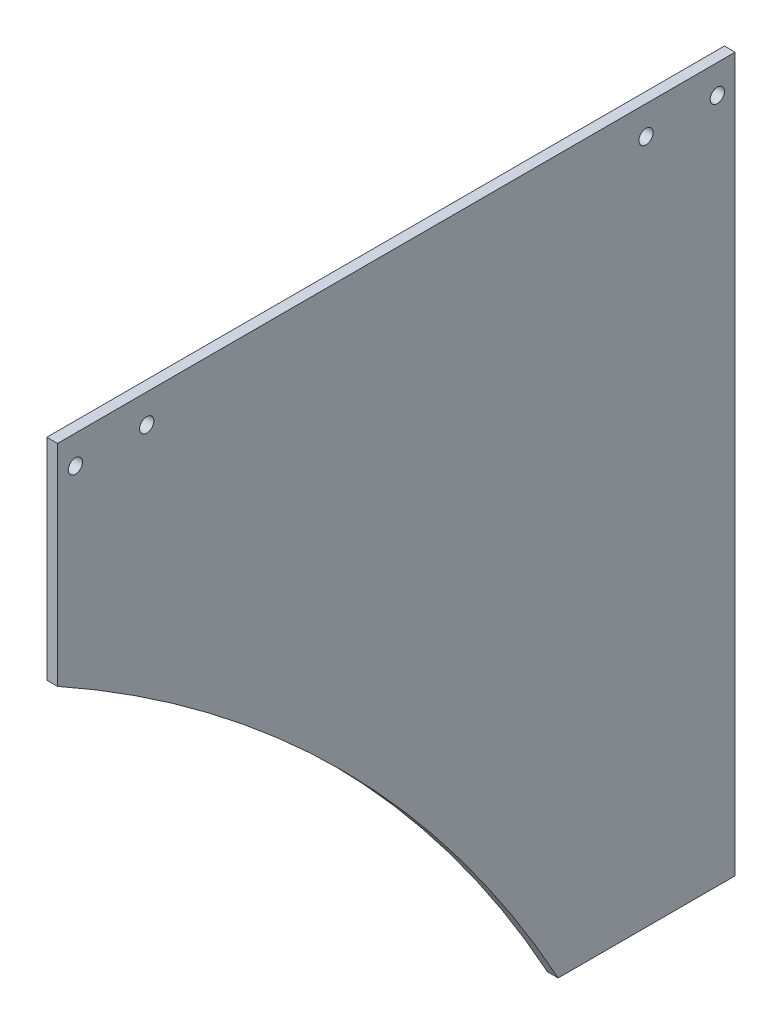
from build123d import *

# Parameters (mm, degrees)
SKETCH_1_R             = 2
SM_BASE_FLANGE_1_DEPTH = 3


# Sheet-metal steps are written as plain solids
with BuildPart() as part:
    # Sketch 1 → Базовая кромка1 (new body)
    with BuildSketch(Plane(origin=(0, 0, 0), x_dir=(0, 0, -1), z_dir=(1, 0, 0))):
        with BuildLine():
            Line((-49.62399479, 0), (0, 0))
            Line((0, 0), (0, 200))
            Line((0, 200), (-190, 200))
            Line((-190, 200), (-190, 141))
            ThreePointArc((-190, 141), (-109.877663421, 80.390369629), (-49.62399479, 0))
        make_face()
        with Locations((-185, 192)):
            Circle(SKETCH_1_R, mode=Mode.SUBTRACT)
        with Locations((-165, 192)):
            Circle(SKETCH_1_R, mode=Mode.SUBTRACT)
        with Locations((-25, 192)):
            Circle(SKETCH_1_R, mode=Mode.SUBTRACT)
        with Locations((-5, 192)):
            Circle(SKETCH_1_R, mode=Mode.SUBTRACT)
    extrude(amount=-SM_BASE_FLANGE_1_DEPTH)


solid = part.part
